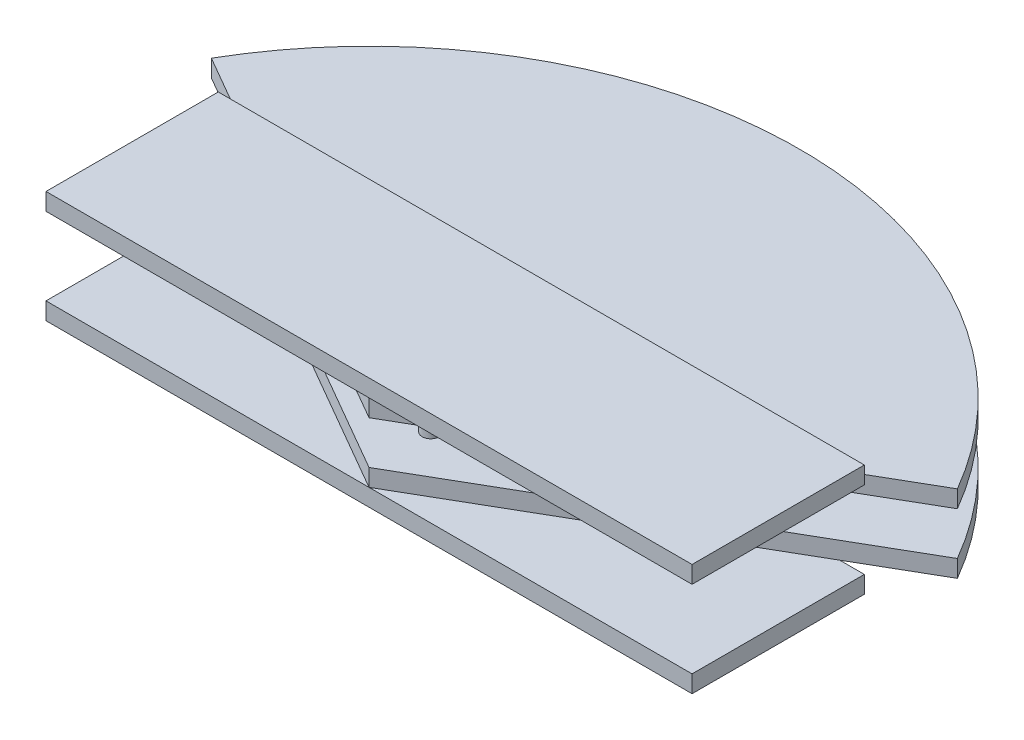
from build123d import *

# Parameters (mm, degrees)
BOSS_EXTRUDE2_DEPTH = 8
SKETCH5_W           = 300
SKETCH5_H           = 80
BOSS_EXTRUDE3_DEPTH = 8
SKETCH6_R           = 4
BOSS_EXTRUDE4_DEPTH = 20
BOSS_EXTRUDE5_START = 8
BOSS_EXTRUDE5_DEPTH = 8
SKETCH8_W           = 300
SKETCH8_H           = 80
BOSS_EXTRUDE6_DEPTH = 8


with BuildPart() as part:
    # Sketch4 → Boss-Extrude2 (new body)
    with BuildSketch(Plane(origin=(0, 0, 0), x_dir=(1, 0, 0), z_dir=(0, 1, 0))):
        with BuildLine():
            Line((0, 0), (173.205080757, 100))
            ThreePointArc((173.205080757, 100), (0, 200), (-173.205080757, 100))
            Line((-173.205080757, 100), (0, 0))
        make_face()
    extrude(amount=BOSS_EXTRUDE2_DEPTH)

    # Sketch5 → Boss-Extrude3 (add)
    with BuildSketch(Plane(origin=(0, 8, 0), x_dir=(1, 0, 0), z_dir=(0, 1, 0))):
        with Locations((0, 40)):
            Rectangle(SKETCH5_W, SKETCH5_H)
    extrude(amount=BOSS_EXTRUDE3_DEPTH)

    # Sketch6 → Boss-Extrude4 (add)
    with BuildSketch(Plane.XZ):
        with Locations((0, -28.691404077)):
            Circle(SKETCH6_R)
    extrude(amount=BOSS_EXTRUDE4_DEPTH)

    # Sketch7 → Boss-Extrude5 (add)
    with BuildSketch(Plane.XZ.offset(20).offset(BOSS_EXTRUDE5_START)):
        with BuildLine():
            Line((0, 0), (-173.205080757, -100))
            ThreePointArc((-173.205080757, -100), (0, -200), (173.205080757, -100))
            Line((173.205080757, -100), (0, 0))
        make_face()
    extrude(amount=-BOSS_EXTRUDE5_DEPTH)

    # Sketch8 → Boss-Extrude6 (add)
    with BuildSketch(Plane.XZ.offset(28)):
        with Locations((0, -40)):
            Rectangle(SKETCH8_W, SKETCH8_H)
    extrude(amount=BOSS_EXTRUDE6_DEPTH)


solid = part.part
